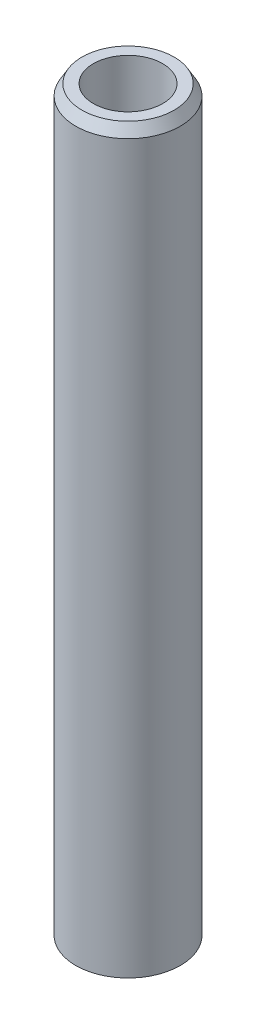
from build123d import *
from OCP.BRepFilletAPI import BRepFilletAPI_MakeChamfer

# Parameters (mm, degrees)
SKETCH1_R           = 27.5
BOSS_EXTRUDE1_DEPTH = 391.032983088
SKETCH2_R           = 18.211442775
CUT_EXTRUDE1_DEPTH  = 393.962204114
CHAMFER1_SIZE       = 5.655686618
CHAMFER1_SIZE2      = 3.265312191


with BuildPart() as part:
    # Sketch1 → Boss-Extrude1 (new body)
    with BuildSketch(Plane(origin=(0, 0, 0), x_dir=(1, 0, 0), z_dir=(0, 1, 0))):
        Circle(SKETCH1_R)
    extrude(amount=BOSS_EXTRUDE1_DEPTH)

    # Sketch2 → Cut-Extrude1 (cut, through all)
    with BuildSketch(Plane(origin=(0, 0, 0), x_dir=(1, 0, 0), z_dir=(0, 1, 0))):
        Circle(SKETCH2_R)
    extrude(amount=CUT_EXTRUDE1_DEPTH, mode=Mode.SUBTRACT)

    # Chamfer1: one chamfer whose edges measure the first distance from different faces: ONE call of the kernel's chamfer builder (chamfer() names one face for all edges)
    chamfer1_edges_1 = [part.edges().sort_by_distance(p)[0] for p in [
        (-27.5, 391.032983088, 0),
    ]]
    chamfer1_side_1 = [part.faces().sort_by_distance(p)[0] for p in [
        (-27.5, 195.516491544, 0),
    ]]
    chamfer1_edges_2 = [part.edges().sort_by_distance(p)[0] for p in [
        (-27.5, 0, 0),
    ]]
    chamfer1_side_2 = [part.faces().sort_by_distance(p)[0] for p in [
        (-26.722182541, 0, 0),
    ]]
    chamfer1 = BRepFilletAPI_MakeChamfer(part.part.solid().wrapped)
    for e in chamfer1_edges_1:
        chamfer1.Add(CHAMFER1_SIZE, CHAMFER1_SIZE2, e.wrapped, chamfer1_side_1[0].wrapped)  # the first distance lies on this face
    for e in chamfer1_edges_2:
        chamfer1.Add(CHAMFER1_SIZE, CHAMFER1_SIZE2, e.wrapped, chamfer1_side_2[0].wrapped)  # the first distance lies on this face
    add(Compound.cast(chamfer1.Shape()), mode=Mode.REPLACE)


solid = part.part
